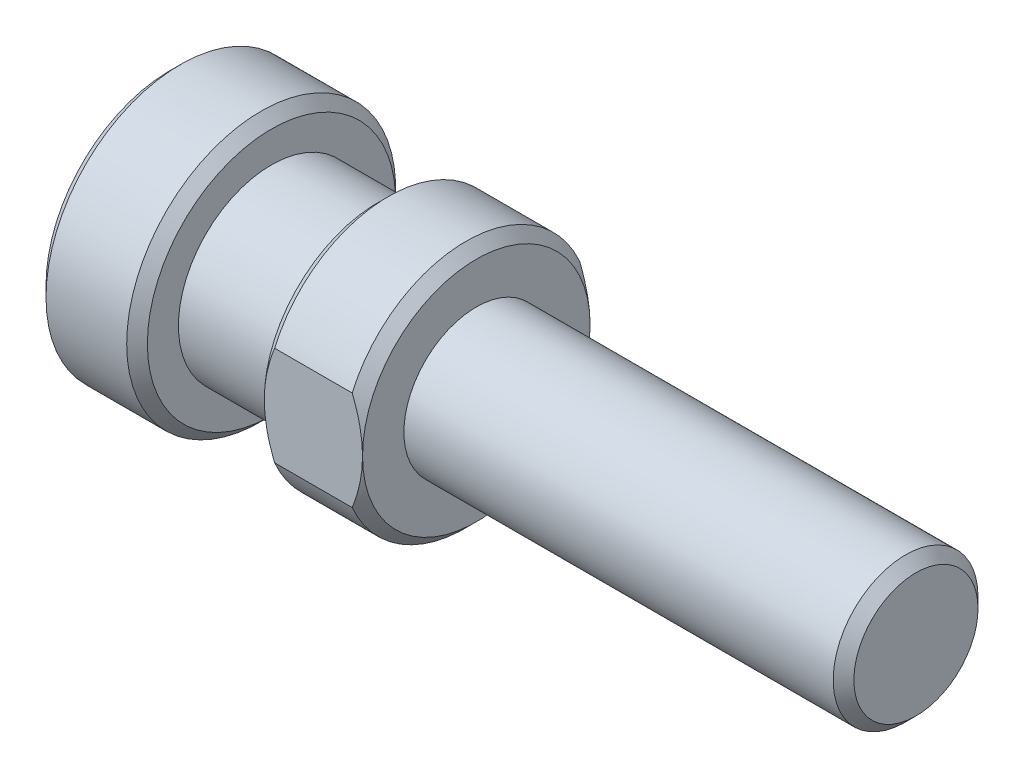
from build123d import *

# Parameters (mm, degrees)
SKETCH_1_R          = 12
EXTRUDE_1_DEPTH     = 9.5
SKETCH_2_R          = 7
EXTRUDE_2_DEPTH     = 42.5
SKETCH_3_R          = 9
EXTRUDE_3_DEPTH     = 10.3
SKETCH_4_R          = 13
EXTRUDE_4_DEPTH     = 9.8
CUT_EXTRUDE_START   = -10
CUT_EXTRUDE_3_DEPTH = 10
CHAMFER_1_SIZE      = 1


with BuildPart() as part:
    # 草圖1 → 伸長1 (new body)
    with BuildSketch(Plane(origin=(0, 0, 0), x_dir=(0, 0, -1), z_dir=(1, 0, 0))):
        Circle(SKETCH_1_R)
    extrude(amount=EXTRUDE_1_DEPTH)

    # 草圖2 → 伸長2 (add)
    with BuildSketch(Plane(origin=(9.5, 0, 0), x_dir=(0, 0, -1), z_dir=(1, 0, 0))):
        Circle(SKETCH_2_R)
    extrude(amount=EXTRUDE_2_DEPTH)

    # 草圖3 → 伸長3 (add)
    with BuildSketch(Plane.ZY):
        with Locations(Location((0, 0, 0), (0, 0, 180))):
            Circle(SKETCH_3_R)
    extrude(amount=EXTRUDE_3_DEPTH)

    # 草圖4 → 伸長4 (add)
    with BuildSketch(Plane.ZY.offset(10.3)):
        Circle(SKETCH_4_R)
    extrude(amount=EXTRUDE_4_DEPTH)

    # 草圖5 → 除料-伸長3 (cut)
    with BuildSketch(Plane(origin=(9.5, 0, 0), x_dir=(0, 0, -1), z_dir=(1, 0, 0)).offset(CUT_EXTRUDE_START)):
        with BuildLine():
            Line((-11, 4.795831523), (-11, -4.795831523))
            ThreePointArc((-11, -4.795831523), (-12, 0), (-11, 4.795831523))
        make_face()
        with BuildLine():
            Line((11, 4.795831523), (11, -4.795831523))
            ThreePointArc((11, -4.795831523), (12, 0), (11, 4.795831523))
        make_face()
    extrude(amount=CUT_EXTRUDE_3_DEPTH, mode=Mode.SUBTRACT)

    # 導角1
    chamfer_1_edges = [part.edges().sort_by_distance(p)[0] for p in [
        (-20.1, 0, -13),
        (-10.3, 0, -13),
        (9.5, 12, 0),
        (9.5, -12, 0),
        (0, 12, 0),
        (0, -12, 0),
        (52, 0, 7),
    ]]
    chamfer(chamfer_1_edges, length=CHAMFER_1_SIZE - 0.0001)  # a hair under: the kernel refuses the full size


solid = part.part
